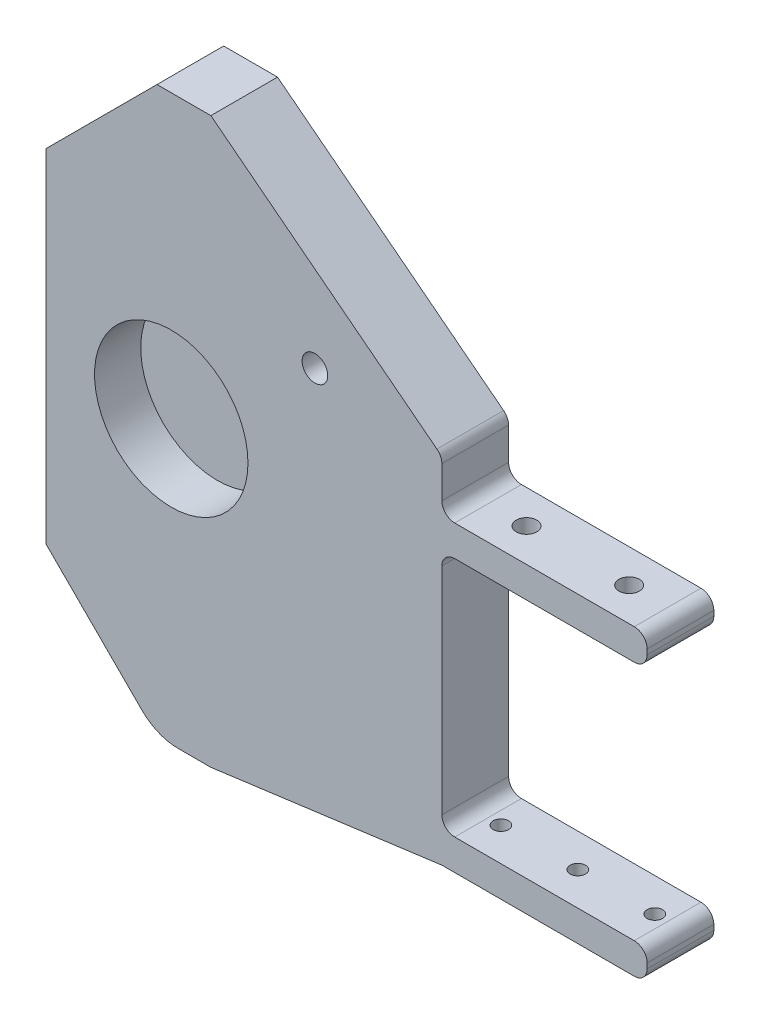
from build123d import *

# Parameters (mm, degrees)
RESSALTO_EXTRUS_O1_DEPTH = 6.5
ESBO_O2_R                = 14.95
CORTE_EXTRUS_O1_DEPTH    = 9
ESBO_O3_R                = 2.5
CORTE_EXTRUS_O2_DEPTH    = 13
FILETE1_R                = 10
ESBO_O4_R                = 2
CORTE_EXTRUS_O3_DEPTH    = 10
ESBO_O6_R                = 2
CORTE_EXTRUS_O4_DEPTH    = 10
ESBO_O7_R                = 1.5
CORTE_EXTRUS_O5_DEPTH    = 10
FILETE2_R                = 2.5


with BuildPart() as part:
    # Esboço1 → Ressalto-extrusão1 (new, symmetric)
    with BuildSketch(Plane.XY):
        Polygon((32.742040246, 55), (4.980147158, 55), (-22.781745931, 55), (-44.375431078, 33.406314852), (-44.375431078, -33.406314852), (-22.781745931, -55), (32.742040246, -55), (32.742040246, -49), (72.742040246, -49), (72.742040246, -43), (32.742040246, -43), (32.742040246, 4), (72.742040246, 4), (72.742040246, 10), (32.742040246, 10), align=None)
    extrude(amount=RESSALTO_EXTRUS_O1_DEPTH, both=True)

    # Esboço2 → Corte-extrusão1 (cut)
    with BuildSketch(Plane.XY.offset(6.5)):
        with Locations((-20, 0)):
            Circle(ESBO_O2_R)
    extrude(amount=-CORTE_EXTRUS_O1_DEPTH, mode=Mode.SUBTRACT)

    # Esboço3 → Corte-extrusão2 (cut)
    with BuildSketch(Plane.XY.offset(6.5)):
        with Locations((8, 22.5)):
            Circle(ESBO_O3_R)
        Polygon((-12.281745931, -55), (32.742040246, -49), (32.742040246, -55), align=None)
        Polygon((32.742040246, 55), (-12.281745931, 55), (32.742040246, 20), align=None)
    extrude(amount=-CORTE_EXTRUS_O2_DEPTH, mode=Mode.SUBTRACT)

    # Filete1
    filete1_edges = [part.edges().sort_by_distance(p)[0] for p in [
        (-22.781745931, -55, 0),
    ]]
    fillet(filete1_edges, radius=FILETE1_R)

    # Esboço4 → Corte-extrusão3 (cut)
    with BuildSketch(Plane(origin=(0, 0, -6.5), x_dir=(-1, 0, 0), z_dir=(0, 0, -1))):
        with Locations((36.375431078, 8.406314852)):
            Circle(ESBO_O4_R)
        with Locations((12.955431078, -16.593685148)):
            Circle(ESBO_O4_R)
        with Locations((22.375431078, -27.593685148)):
            Circle(ESBO_O4_R)
    extrude(amount=-CORTE_EXTRUS_O3_DEPTH, mode=Mode.SUBTRACT)

    # Esboço6 → Corte-extrusão4 (cut)
    with BuildSketch(Plane(origin=(0, 10, 0), x_dir=(1, 0, 0), z_dir=(0, 1, 0))):
        with Locations((42.742040246, -0.001621735)):
            Circle(ESBO_O6_R)
        with Locations((62.742040246, -0.001621735)):
            Circle(ESBO_O6_R)
    extrude(amount=-CORTE_EXTRUS_O4_DEPTH, mode=Mode.SUBTRACT)

    # Esboço7 → Corte-extrusão5 (cut)
    with BuildSketch(Plane.XZ.offset(49)):
        with Locations((37.742040246, 0)):
            Circle(ESBO_O7_R)
        with Locations((52.742040246, 0)):
            Circle(ESBO_O7_R)
        with Locations((67.742040246, 0)):
            Circle(ESBO_O7_R)
    extrude(amount=-CORTE_EXTRUS_O5_DEPTH, mode=Mode.SUBTRACT)

    # Filete2
    filete2_edges = [part.edges().sort_by_distance(p)[0] for p in [
        (72.742040246, -49, 0),
        (72.742040246, -43, 0),
        (72.742040246, 4, 0),
        (72.742040246, 10, 0),
        (32.742040246, 20, 0),
        (32.742040246, -43, 0),
        (32.742040246, 10, 0),
        (32.742040246, 4, 0),
    ]]
    fillet(filete2_edges, radius=FILETE2_R)


solid = part.part
